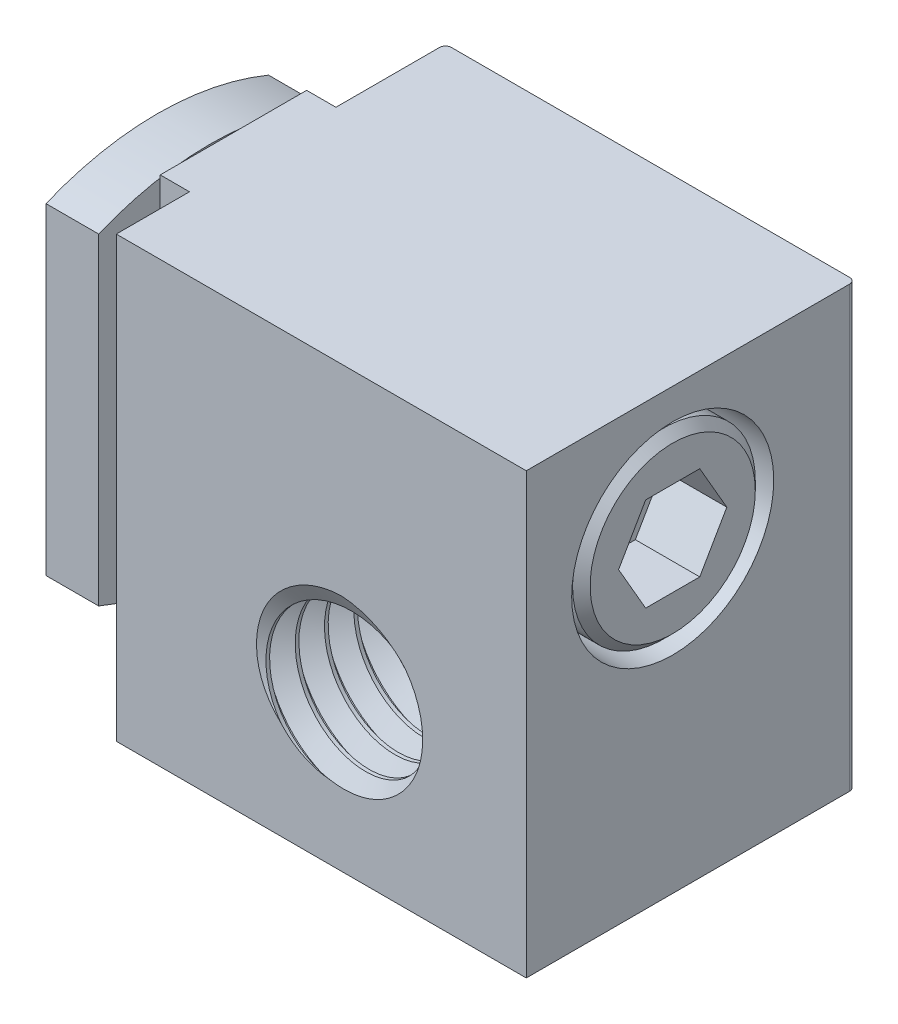
from build123d import *
from build123d.topology import SkipClean

# Parameters (mm, degrees)
MAIN_BODY_DEPTH        = 9.525
MAIN_BODY_DEPTH_BACK   = 9.525
TAP_HOLE_DEPTH         = 19.593441929
TAP_HOLE_DEPTH_BACK    = 19.593441929
SKETCH6_R              = 3.175
RAIL_START             = -7.874
RAIL_GUIDE_DEPTH       = 2.286
SKETCH11_R             = 3.06324
SKETCH11_R_2           = 2.5527
BOSS_EXTRUDE2_DEPTH    = 0.73152
THRU_HOLE_DEPTH        = 19.593441929
THRU_HOLE_DEPTH_BACK   = 19.593441929
SKETCH7_R              = 2.5527
COUNTERBORE_START      = 12.192
SKETCH8_R              = 4.3815
COUNTERBORE_DEPTH      = 5.334
SCREW_SHAFT_DEPTH      = 9.398
SCREW_SHAFT_DEPTH_BACK = 12.192
SKETCH12_R             = 2.5527
SKETCH13_R             = 3.9624
SCREW_HEAD_DEPTH       = 2.794
CUT_EXTRUDE1_DEPTH     = 2.794
FILLET1_R              = 0.254
CHAMFER4_SIZE          = 0.381
CUT_SWEEP4_PITCH       = 1.27
SKETCH17_W             = 17.78
SKETCH17_H             = 19.05
CUT_EXTRUDE2_DEPTH     = 6.35


with BuildPart() as part:
    # Sketch5 → Main Body (new, two sides: drawn at the far end of the back side and taken through both)
    with BuildSketch(Plane(origin=(0, 0, 0), x_dir=(1, 0, 0), z_dir=(0, 1, 0)).offset(-MAIN_BODY_DEPTH_BACK)):
        Polygon((12.192, -10.3124), (12.192, 10.3124), (-5.588, 10.3124), (-5.588, 5.5626), (-6.858, 5.5626), (-6.858, -0.7874), (-5.588, -0.7874), (-5.588, -10.3124), align=None)
    extrude(amount=MAIN_BODY_DEPTH + MAIN_BODY_DEPTH_BACK)

    # Sketch6 → Tap Hole (cut, two sides: drawn at the far end of the back side and taken through both)
    with BuildSketch(Plane.XY.offset(-TAP_HOLE_DEPTH_BACK)):
        with Locations((3.937, -3.175)):
            Circle(SKETCH6_R)
    extrude(amount=TAP_HOLE_DEPTH + TAP_HOLE_DEPTH_BACK, mode=Mode.SUBTRACT)


with BuildPart() as body_2:
    # Sketch10 → Rail Guide (new body)
    with BuildSketch(Plane(origin=(0, 0, 0), x_dir=(0, 0, -1), z_dir=(1, 0, 0)).offset(RAIL_START)):
        with BuildLine():
            Line((7.2136, 7.62), (7.2136, -6.35))
            ThreePointArc((7.2136, -6.35), (2.3876, -7.313088157), (-2.4384, -6.35))
            Line((-2.4384, -6.35), (-2.4384, 7.62))
            ThreePointArc((-2.4384, 7.62), (2.3876, 8.583088157), (7.2136, 7.62))
        make_face()
    extrude(amount=-RAIL_GUIDE_DEPTH)

    # Sketch11 → Boss-Extrude2 (add)
    with BuildSketch(Plane.ZY.offset(10.16)):
        with Locations(Location((-2.3876, 3.81, 0), (0, 0, 180))):
            Circle(SKETCH11_R)
        with Locations((-2.3876, 3.81)):
            Circle(SKETCH11_R_2, mode=Mode.SUBTRACT)
    extrude(amount=BOSS_EXTRUDE2_DEPTH)


with BuildPart() as thru_hole_tool:
    # Sketch7 → Thru Hole (new, two sides: drawn at the far end of the back side and taken through both)
    with SkipClean():  # the faces are left unmerged after this step: merging them gives an invalid solid
        with BuildSketch(Plane(origin=(0, 0, 0), x_dir=(0, 0, -1), z_dir=(1, 0, 0)).offset(-THRU_HOLE_DEPTH_BACK)):
            with Locations((2.3876, 3.81)):
                Circle(SKETCH7_R)
        extrude(amount=THRU_HOLE_DEPTH + THRU_HOLE_DEPTH_BACK)


with BuildPart() as part_1:
    with SkipClean():  # the faces are left unmerged after this step: merging them gives an invalid solid
        add(part.part)

        # Thru Hole: cut by thru_hole_tool
        add(thru_hole_tool.part, mode=Mode.SUBTRACT)

    # Sketch8 → Counterbore (cut)
    with BuildSketch(Plane(origin=(0, 0, 0), x_dir=(0, 0, -1), z_dir=(1, 0, 0)).offset(COUNTERBORE_START)):
        with Locations((2.3876, 3.81)):
            Circle(SKETCH8_R)
    extrude(amount=-COUNTERBORE_DEPTH, mode=Mode.SUBTRACT)

    # Fillet1
    fillet1_edges = [part_1.edges().sort_by_distance(p)[0] for p in [
        (-5.588, 0, 10.3124),
        (-5.588, 0, -10.3124),
        (12.192, 0, -10.3124),
        (12.192, 0, 10.3124),
    ]]
    fillet(fillet1_edges, radius=FILLET1_R)

    # Cut-Sweep4: the profile of Sketch15 screwed along a right-hand helix of 17.24 turns, 8 arcs to a turn; built about Z, then put on its axis
    cut_sweep4_z = Axis((0, 0, 0), (0, 0, 1))
    cut_sweep4_corners = [(3.999889197, 0, -0.635), (3.106259234, 0, -1.1509375), (3.106259234, 0, 0.0396875), (3.999889197, 0, -0.47625)]
    with BuildLine(mode=Mode.PRIVATE) as cut_sweep4_profile:
        Line(cut_sweep4_corners[0], cut_sweep4_corners[1])
        Line(cut_sweep4_corners[1], cut_sweep4_corners[2])
        Line(cut_sweep4_corners[2], cut_sweep4_corners[3])
        Line(cut_sweep4_corners[3], cut_sweep4_corners[0])
    cut_sweep4_cap = Face(cut_sweep4_profile.wire())
    cut_sweep4_turn_angles = [0, 22.5, 45, 67.5, 90, 112.5, 135, 157.5, 180, 202.5, 225, 247.5, 270, 292.5, 315, 337.5, 360]
    cut_sweep4_turn_weights = [1, 0.9238795325112867, 1, 0.9238795325112867, 1, 0.9238795325112867, 1, 0.9238795325112867, 1, 0.9238795325112867, 1, 0.9238795325112867, 1, 0.9238795325112867, 1, 0.9238795325112867, 1]
    cut_sweep4_turn_rails = [Edge.make_bspline([Vector(p[0], p[1], 0).rotate(cut_sweep4_z, cut_sweep4_turn_angles[k]) / cut_sweep4_turn_weights[k] + Vector(0, 0, p[2] + CUT_SWEEP4_PITCH * cut_sweep4_turn_angles[k] / 360) for k in range(17)], [0, 0, 0, 1, 1, 2, 2, 3, 3, 4, 4, 5, 5, 6, 6, 7, 7, 8, 8, 8], 2, cut_sweep4_turn_weights) for p in cut_sweep4_corners]
    cut_sweep4_turn_sides = [Face.make_surface_from_curves(cut_sweep4_turn_rails[p[0]], cut_sweep4_turn_rails[p[1]]) for p in [(0, 1), (1, 2), (2, 3), (3, 0)]]
    cut_sweep4_last_angles = [6120, 6142.5, 6165, 6185.7, 6206.4]
    cut_sweep4_last_weights = [1, 0.9238795325112867, 1, 0.9354440308299611, 1]
    cut_sweep4_last_rails = [Edge.make_bspline([Vector(p[0], p[1], 0).rotate(cut_sweep4_z, cut_sweep4_last_angles[k]) / cut_sweep4_last_weights[k] + Vector(0, 0, p[2] + CUT_SWEEP4_PITCH * cut_sweep4_last_angles[k] / 360) for k in range(5)], [0, 0, 0, 1, 1, 2, 2, 2], 2, cut_sweep4_last_weights) for p in cut_sweep4_corners]
    cut_sweep4_last_sides = [Face.make_surface_from_curves(cut_sweep4_last_rails[p[0]], cut_sweep4_last_rails[p[1]]) for p in [(0, 1), (1, 2), (2, 3), (3, 0)]]
    cut_sweep4 = Plane(origin=(3.937, -3.175, -10.3124), x_dir=(-1, 0, 0), z_dir=(0, 0, 1)) * Solid(Shell([*[p.moved(Location((0, 0, CUT_SWEEP4_PITCH * i))) for i in range(17) for p in cut_sweep4_turn_sides], *cut_sweep4_last_sides, cut_sweep4_cap, cut_sweep4_cap.rotate(cut_sweep4_z, 6206.4).moved(Location((0, 0, CUT_SWEEP4_PITCH * 6206.4 / 360)))]))
    add(cut_sweep4, mode=Mode.SUBTRACT)

    # Sketch17 → Cut-Extrude2 (cut)
    with BuildSketch(Plane.XY.offset(10.3124)):
        with Locations((3.302, 0)):
            Rectangle(SKETCH17_W, SKETCH17_H)
    extrude(amount=-CUT_EXTRUDE2_DEPTH, mode=Mode.SUBTRACT)


with BuildPart() as body_2_1:
    with SkipClean():  # the faces are left unmerged after this step: merging them gives an invalid solid
        add(body_2.part)

        # Thru Hole: cut by thru_hole_tool
        add(thru_hole_tool.part, mode=Mode.SUBTRACT)


with BuildPart() as body_3:
    # Sketch12 → Screw Shaft (new, two sides: drawn at the far end of the back side and taken through both)
    with BuildSketch(Plane(origin=(0, 0, 0), x_dir=(0, 0, -1), z_dir=(1, 0, 0)).offset(-SCREW_SHAFT_DEPTH_BACK)):
        with Locations((2.3876, 3.81)):
            Circle(SKETCH12_R)
    extrude(amount=SCREW_SHAFT_DEPTH + SCREW_SHAFT_DEPTH_BACK)


with BuildPart() as body_4:
    # Sketch13 → Screw Head (new body)
    with BuildSketch(Plane(origin=(9.398, 0, 0), x_dir=(0, 0, -1), z_dir=(1, 0, 0))):
        with Locations((2.3876, 3.81)):
            Circle(SKETCH13_R)
    extrude(amount=SCREW_HEAD_DEPTH)

    # Sketch14 → Cut-Extrude1 (cut)
    with BuildSketch(Plane(origin=(12.192, 0, 0), x_dir=(0, 0, -1), z_dir=(1, 0, 0))):
        Polygon((4.733951494, 3.81), (3.560775747, 5.842), (1.214424253, 5.842), (0.041248506, 3.81), (1.214424253, 1.778), (3.560775747, 1.778), align=None)
    extrude(amount=-CUT_EXTRUDE1_DEPTH, mode=Mode.SUBTRACT)

    # Combine3: union body 3
    add(body_3.part)

    # Chamfer4
    chamfer4_edges = [body_4.edges().sort_by_distance(p)[0] for p in [
        (-12.192, 3.81, 0.1651),
        (12.192, 3.81, 1.5748),
    ]]
    chamfer(chamfer4_edges, length=CHAMFER4_SIZE)


solid = Compound([part_1.part, body_2_1.part, body_4.part])
